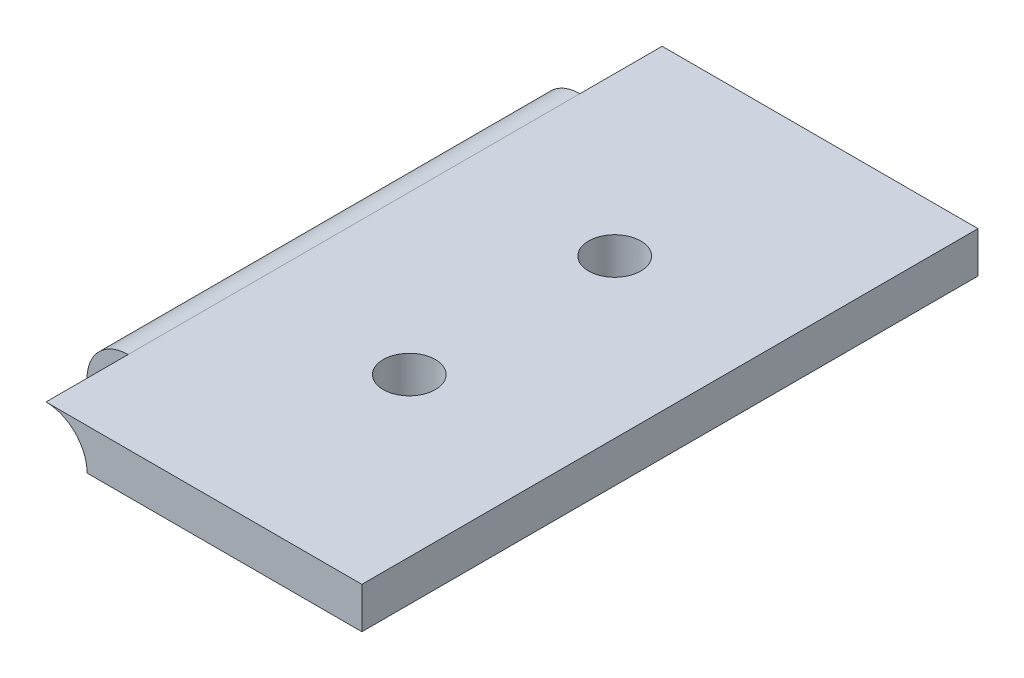
from build123d import *
from build123d.topology import SkipClean

# Parameters (mm, degrees)
SKETCH1_W           = 38.452994616
SKETCH1_H           = 5
BOSS_EXTRUDE1_DEPTH = 75
BOSS_EXTRUDE2_START = -10
BOSS_EXTRUDE2_DEPTH = 55
SKETCH5_R           = 3.175
CUT_EXTRUDE8_DEPTH  = 55
CUT_EXTRUDE9_DEPTH  = 75
CUT_EXTRUDE10_DEPTH = 10
CUT_EXTRUDE11_START = -65
CUT_EXTRUDE11_DEPTH = 10


with BuildPart() as part:
    # Sketch1 → Boss-Extrude1 (new body)
    with BuildSketch(Plane.XY):
        with Locations((25, -2.5)):
            Rectangle(SKETCH1_W, SKETCH1_H)
    extrude(amount=-BOSS_EXTRUDE1_DEPTH)

    # Sketch1<4> → Boss-Extrude2 (add)
    with BuildSketch(Plane.XY.offset(BOSS_EXTRUDE2_START)):
        with BuildLine():
            Line((5.773502692, -2.5), (5.773502692, 0))
            ThreePointArc((5.773502692, 0), (3.273502679, -0.669872988), (1.443375659, -2.500000025))
            ThreePointArc((1.443375659, -2.500000025), (4.47940748, -9.829629135), (10.773502692, -5))
            Line((10.773502692, -5), (8.273502692, -5))
            ThreePointArc((8.273502692, -5), (4.005735739, -6.767766953), (5.773502692, -2.5))
        make_face()
    extrude(amount=-BOSS_EXTRUDE2_DEPTH)

    # Sketch5 → Cut-Extrude8 (cut)
    with BuildSketch(Plane.XZ.offset(5)):
        with Locations((25, -25)):
            Circle(SKETCH5_R)
        with Locations((25, -50)):
            Circle(SKETCH5_R)
    extrude(amount=-CUT_EXTRUDE8_DEPTH, mode=Mode.SUBTRACT)

    # Sketch1<14> → Cut-Extrude9 (cut)
    with SkipClean():  # the faces are left unmerged after this step: merging them gives an invalid solid
        with BuildSketch(Plane.XY):
            with BuildLine():
                ThreePointArc((8.273502692, -5), (7.541269645, -3.232233047), (5.773502692, -2.5))
                Line((5.773502692, -2.5), (5.773502692, -5))
                Line((5.773502692, -5), (8.273502692, -5))
            make_face()
        extrude(amount=-CUT_EXTRUDE9_DEPTH, mode=Mode.SUBTRACT)

    # Sketch1<15> → Cut-Extrude10 (cut)
    with SkipClean():  # the faces are left unmerged after this step: merging them gives an invalid solid
        with BuildSketch(Plane.XY):
            with BuildLine():
                ThreePointArc((10.773502692, -5), (9.309036598, -1.464466094), (5.773502692, 0))
                Line((5.773502692, 0), (5.773502692, -2.5))
                ThreePointArc((5.773502692, -2.5), (7.541269645, -3.232233047), (8.273502692, -5))
                Line((8.273502692, -5), (10.773502692, -5))
            make_face()
        extrude(amount=-CUT_EXTRUDE10_DEPTH, mode=Mode.SUBTRACT)

    # Sketch1<16> → Cut-Extrude11 (cut)
    with BuildSketch(Plane.XY.offset(CUT_EXTRUDE11_START)):
        with BuildLine():
            ThreePointArc((10.773502692, -5), (9.309036598, -1.464466094), (5.773502692, 0))
            Line((5.773502692, 0), (5.773502692, -2.5))
            ThreePointArc((5.773502692, -2.5), (7.541269645, -3.232233047), (8.273502692, -5))
            Line((8.273502692, -5), (10.773502692, -5))
        make_face()
    extrude(amount=-CUT_EXTRUDE11_DEPTH, mode=Mode.SUBTRACT)


solid = part.part
